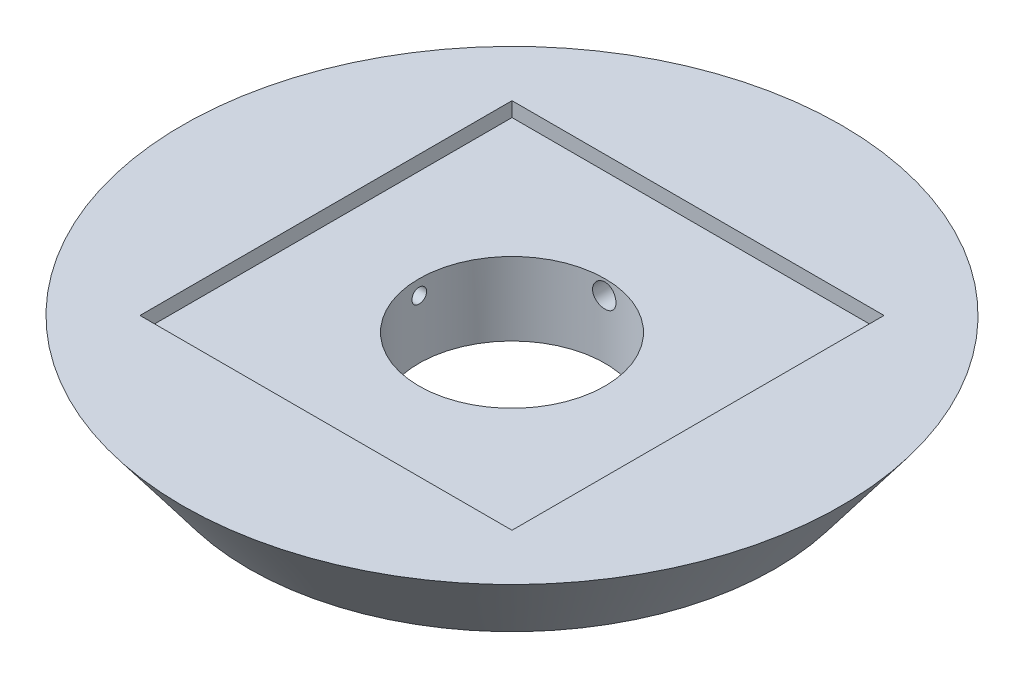
from build123d import *

# Parameters (mm, degrees)
SKETCH5_R          = 6.35
CUT_EXTRUDE1_DEPTH = 33.380549717
SKETCH7_W          = 25.4
SKETCH7_H          = 25.4
CUT_EXTRUDE2_DEPTH = 1
SKETCH8_R          = 0.8
CUT_EXTRUDE3_DEPTH = 33.380549717
SKETCH9_R          = 0.5
CUT_EXTRUDE4_DEPTH = 33.380549875


# Read off the part's stored shape, not the designer's step: Loft1
with BuildPart() as part:
    # Loft1 outline → Loft1 (revolve)
    with BuildSketch(Plane.XY):
        Polygon((0, 0), (17.96, 0), (22.5, 6), (0, 6), align=None)
    revolve(axis=Axis((0, 0, 0), (0, 1, 0)))

    # Sketch5 → Cut-Extrude1 (cut, through all)
    with BuildSketch(Plane(origin=(0, 6, 0), x_dir=(1, 0, 0), z_dir=(0, 1, 0))):
        with Locations(Location((0, 0, 0), (0, 0, 270))):
            Circle(SKETCH5_R)
    extrude(amount=-CUT_EXTRUDE1_DEPTH, mode=Mode.SUBTRACT)

    # Sketch7 → Cut-Extrude2 (cut)
    with BuildSketch(Plane(origin=(0, 6, 0), x_dir=(1, 0, 0), z_dir=(0, 1, 0))):
        Rectangle(SKETCH7_W, SKETCH7_H)
    extrude(amount=-CUT_EXTRUDE2_DEPTH, mode=Mode.SUBTRACT)

    # Sketch8 → Cut-Extrude3 (cut, through all)
    with BuildSketch(Plane.XY):
        with Locations((0, 4)):
            Circle(SKETCH8_R)
    extrude(amount=-CUT_EXTRUDE3_DEPTH, mode=Mode.SUBTRACT)

    # Sketch9 → Cut-Extrude4 (cut, through all)
    with BuildSketch(Plane(origin=(0, 0, 0), x_dir=(0, 0, -1), z_dir=(1, 0, 0))):
        with Locations((0, 4)):
            Circle(SKETCH9_R)
    extrude(amount=-CUT_EXTRUDE4_DEPTH, mode=Mode.SUBTRACT)


solid = part.part
